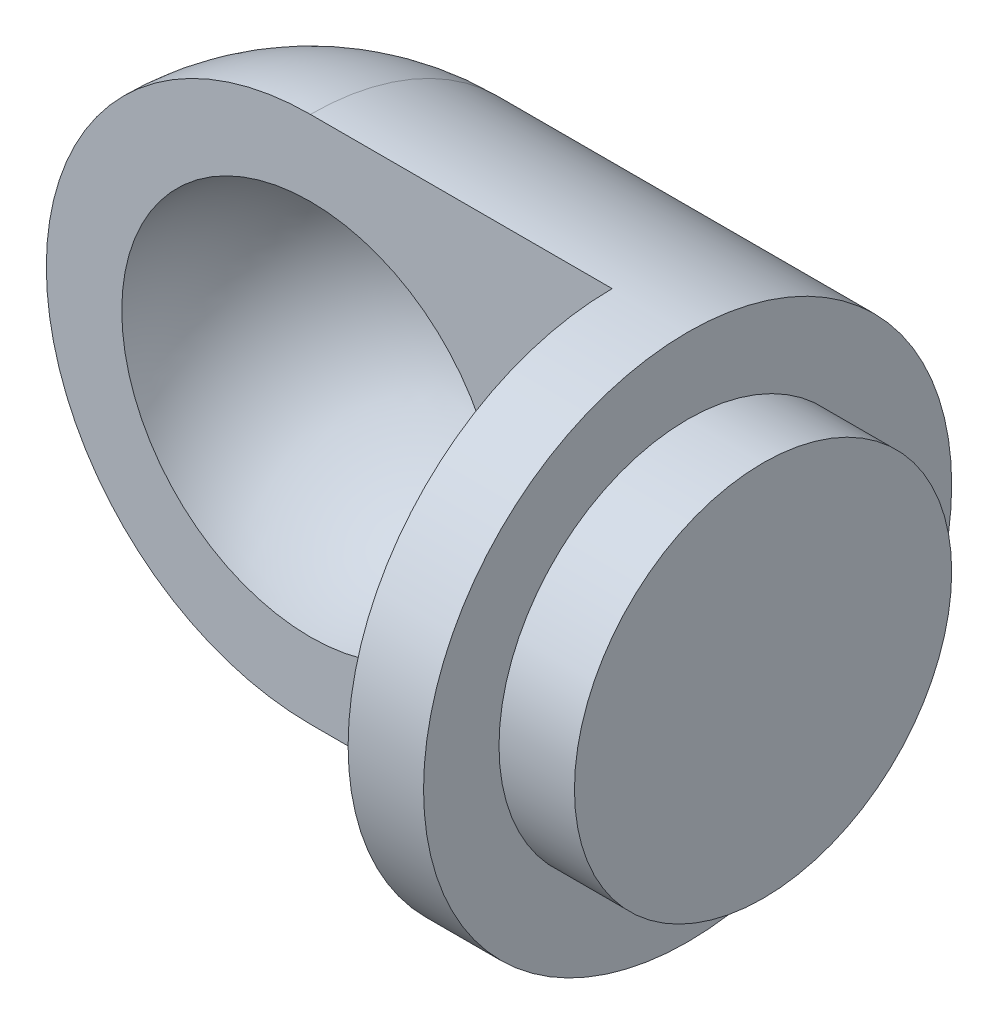
from build123d import *

# Parameters (mm, degrees)
REVOLVE1_ANGLE      = 180
SKETCH4_R           = 25
BOSS_EXTRUDE1_DEPTH = 10
SKETCH5_R           = 35
BOSS_EXTRUDE2_DEPTH = 10


# Read off the part's stored shape, not the designer's step: Revolve1
with BuildPart() as part:
    # Revolve1 outline → Revolve1 (revolve)
    with BuildSketch(Plane(origin=(0, 0, 0), x_dir=(0, -1, 0), z_dir=(0, 0, 1))):
        with BuildLine():
            Line((0, -75), (0, -85))
            ThreePointArc((0, -85), (24.748737342, -74.748737342), (35, -50))
            Line((35, -50), (35, 0))
            Line((35, 0), (0, 0))
            Line((0, 0), (0, -25))
            ThreePointArc((0, -25), (25, -50), (0, -75))
        make_face()
    revolve(axis=Axis((0, 0, 0), (1, 0, 0)), revolution_arc=REVOLVE1_ANGLE)

    # Sketch4 → Boss-Extrude1 (add)
    with BuildSketch(Plane(origin=(0, 0, 0), x_dir=(0, 0, -1), z_dir=(1, 0, 0))):
        with Locations(Location((0, 0, 0), (0, 0, 270))):
            Circle(SKETCH4_R)
    extrude(amount=BOSS_EXTRUDE1_DEPTH)

    # Sketch5 → Boss-Extrude2 (add)
    with BuildSketch(Plane(origin=(0, 0, 0), x_dir=(0, 0, -1), z_dir=(1, 0, 0))):
        with Locations(Location((0, 0, 0), (0, 0, 180))):
            Circle(SKETCH5_R)
    extrude(amount=-BOSS_EXTRUDE2_DEPTH)


solid = part.part
